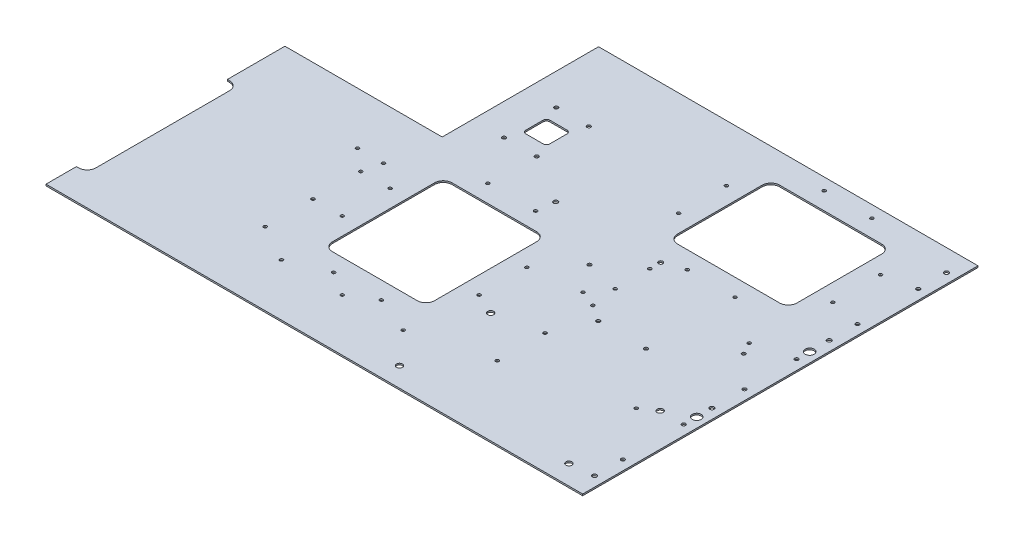
from build123d import *

# Parameters (mm, degrees)
BASE_FLANGE1_DEPTH                             = 577.85
SKETCH7_W                                      = 354.647501395
SKETCH7_H                                      = 622.579194054
CE_00_BIG_CORNER_CUT_DEPTH                     = 641.586892148
SKETCH8_R                                      = 2.3876
SKETCH8_R_2                                    = 3.175
CE_00_EXHAUST_VENT_DEPTH                       = 7.62
SKETCH13_R                                     = 2.3876
CE_00_HOLES_PLENUM_0_188_DEPTH                 = 7.62
SKETCH12_R                                     = 2.3876
SKETCH12_R_2                                   = 2.7051
CE_00_INTAKE_VENT_0_188_0_213_DEPTH            = 7.62
SKETCH14_R                                     = 4.3688
CE_00_HOLES_BOTTOM_SUPPORT_0_344_DEPTH         = 7.62
CE_00_HOLES_BOTTOM_FAN_PLATES_0_188_REACH      = 707.606
SKETCH21_R                                     = 2.3876
SKETCH21_R_2                                   = 3.175
SKETCH19_R                                     = 2.3876
CE_00_HOLES_ELECTRONICS_LOCATION_0_188_DEPTH   = 7.62
SKETCH15_R                                     = 2.3876
CE_00_HOLES_PLENUM_BOTTOM_0_188_DEPTH          = 7.62
SKETCH16_R                                     = 2.7051
CE_00_POWER_CONNECTOR_0_188_DEPTH              = 2.54
CE_00_HOLES_INTAKE_BRACKET_0_188_REACH         = 688.172
SKETCH24_R                                     = 2.3876
SKETCH17_R                                     = 3.175
SKETCH17_R_2                                   = 2.7051
SKETCH17_R_3                                   = 6.5532
CE_00_HOLES_SIDE_LOWR_FLANGE_0_213_0_250_DEPTH = 7.62
CE_00_TOP_EDGE_CUT_DEPTH                       = 50.8
FLAT_PATTERN1_START                            = -234.95
FLAT_PATTERN1_OUTLINE_R                        = 2.3876
FLAT_PATTERN1_OUTLINE_R_2                      = 4.3688
FLAT_PATTERN1_OUTLINE_R_3                      = 2.7051
FLAT_PATTERN1_OUTLINE_R_4                      = 3.175
FLAT_PATTERN1_DEPTH                            = 376.936
FLAT_PATTERN1_START_2                          = -237.236
FLAT_PATTERN1_2_OUTLINE_R                      = 2.3876
FLAT_PATTERN1_2_OUTLINE_R_2                    = 4.3688
FLAT_PATTERN1_2_OUTLINE_R_3                    = 2.7051
FLAT_PATTERN1_2_OUTLINE_R_4                    = 3.175
FLAT_PATTERN1_2_OUTLINE_R_5                    = 6.5532
FLAT_PATTERN1_2_DEPTH                          = 2.286


with BuildPart() as part:
    # Base-Flange1: sheet metal written as solids
    # Sketch1 → Base-Flange1 (new body)
    with BuildSketch(Plane.XY):
        with BuildLine():
            Line((139.7, -203.2), (139.7, -233.807))
            ThreePointArc((139.7, -233.807), (139.365223051, -234.615223051), (138.557, -234.95))
            Line((138.557, -234.95), (-138.557, -234.95))
            ThreePointArc((-138.557, -234.95), (-139.365223051, -234.615223051), (-139.7, -233.807))
            Line((-139.7, -233.807), (-139.7, 63.026553898))
            ThreePointArc((-139.7, 63.026553898), (-139.612994306, 63.463961061), (-139.365223051, 63.834776949))
            Line((-139.365223051, 63.834776949), (-63.834776949, 139.365223051))
            ThreePointArc((-63.834776949, 139.365223051), (-63.463961061, 139.612994306), (-63.026553898, 139.7))
            Line((-63.026553898, 139.7), (0, 139.7))
            Line((0, 139.7), (0, 141.986))
            Line((0, 141.986), (-63.026553898, 141.986))
            ThreePointArc((-63.026553898, 141.986), (-64.338775388, 141.724982917), (-65.451223051, 140.981669153))
            Line((-65.451223051, 140.981669153), (-140.981669153, 65.451223051))
            ThreePointArc((-140.981669153, 65.451223051), (-141.724982917, 64.338775388), (-141.986, 63.026553898))
            Line((-141.986, 63.026553898), (-141.986, -233.807))
            ThreePointArc((-141.986, -233.807), (-140.981669153, -236.231669153), (-138.557, -237.236))
            Line((-138.557, -237.236), (138.557, -237.236))
            ThreePointArc((138.557, -237.236), (140.981669153, -236.231669153), (141.986, -233.807))
            Line((141.986, -233.807), (141.986, -203.2))
            Line((141.986, -203.2), (139.7, -203.2))
        make_face()
    extrude(amount=-BASE_FLANGE1_DEPTH)

    # Sketch7 → CE-00 Big Corner Cut (cut, through all)
    with BuildSketch(Plane(origin=(0, 0, 0), x_dir=(0, 0, -1), z_dir=(1, 0, 0))):
        with Locations((526.573750698, 317.639597027)):
            Rectangle(SKETCH7_W, SKETCH7_H)
    extrude(amount=-CE_00_BIG_CORNER_CUT_DEPTH, mode=Mode.SUBTRACT)

    # Sketch8 → CE-00 Exhaust Vent (cut)
    with BuildSketch(Plane.ZY.offset(141.986)):
        with Locations(Location((-98.4123, -85.725, 0), (0, 0, 270))):
            Circle(SKETCH8_R)
        with Locations(Location((-98.4123, -155.575, 0), (0, 0, 270))):
            Circle(SKETCH8_R)
        with Locations(Location((-323.8627, -85.725, 0), (0, 0, 270))):
            Circle(SKETCH8_R)
        with Locations(Location((-323.8627, -155.575, 0), (0, 0, 270))):
            Circle(SKETCH8_R)
        with Locations(Location((-246.0625, -20.6248, 0), (0, 0, 270))):
            Circle(SKETCH8_R)
        with Locations(Location((-176.2125, -20.6248, 0), (0, 0, 270))):
            Circle(SKETCH8_R)
        with Locations(Location((-246.0625, -220.6752, 0), (0, 0, 270))):
            Circle(SKETCH8_R)
        with Locations(Location((-176.2125, -220.6752, 0), (0, 0, 270))):
            Circle(SKETCH8_R)
        with Locations(Location((-350.0628, -158.75, 0), (0, 0, 270))):
            Circle(SKETCH8_R_2)
        with BuildLine():
            Line((-285.75, -46.0375), (-136.525, -46.0375))
            ThreePointArc((-136.525, -46.0375), (-127.544743879, -49.757243879), (-123.825, -58.7375))
            Line((-123.825, -58.7375), (-123.825, -182.5625))
            ThreePointArc((-123.825, -182.5625), (-127.544743879, -191.542756121), (-136.525, -195.2625))
            Line((-136.525, -195.2625), (-285.75, -195.2625))
            ThreePointArc((-285.75, -195.2625), (-294.730256121, -191.542756121), (-298.45, -182.5625))
            Line((-298.45, -182.5625), (-298.45, -58.7375))
            ThreePointArc((-298.45, -58.7375), (-294.730256121, -49.757243879), (-285.75, -46.0375))
        make_face()
    extrude(amount=-CE_00_EXHAUST_VENT_DEPTH, mode=Mode.SUBTRACT)

    # Sketch13 → CE-00 Holes Plenum 0.188 (cut)
    with BuildSketch(Plane.ZY.offset(141.986)):
        with Locations((-76.2, -31.75)):
            Circle(SKETCH13_R)
        with Locations((-76.2, -120.65)):
            Circle(SKETCH13_R)
        with Locations((-76.2, -209.55)):
            Circle(SKETCH13_R)
        with Locations((-246.0752, 22.225)):
            Circle(SKETCH13_R)
        with Locations((-176.2252, 22.225)):
            Circle(SKETCH13_R)
        with Locations((-106.3752, 22.225)):
            Circle(SKETCH13_R)
    extrude(amount=-CE_00_HOLES_PLENUM_0_188_DEPTH, mode=Mode.SUBTRACT)

    # Sketch12 → CE-00 Intake Vent 0.188 0.213 (cut)
    with BuildSketch(Plane(origin=(0, -237.236, 0), x_dir=(1, 0, 0), z_dir=(0, 1, 0))):
        with Locations((-34.925, 360.3498)):
            Circle(SKETCH12_R)
        with Locations((34.925, 360.3498)):
            Circle(SKETCH12_R)
        with Locations((-34.925, 560.4002)):
            Circle(SKETCH12_R)
        with Locations((34.925, 560.4002)):
            Circle(SKETCH12_R)
        with Locations((112.7252, 495.3)):
            Circle(SKETCH12_R)
        with Locations((112.7252, 425.45)):
            Circle(SKETCH12_R)
        with Locations((-112.7252, 425.45)):
            Circle(SKETCH12_R)
        with Locations((-112.7252, 495.3)):
            Circle(SKETCH12_R)
        with Locations((34.925, 230.2002)):
            Circle(SKETCH12_R_2)
        with Locations((-34.925, 230.2002)):
            Circle(SKETCH12_R_2)
        with Locations((112.7252, 295.275)):
            Circle(SKETCH12_R_2)
        with Locations((-112.7252, 295.275)):
            Circle(SKETCH12_R_2)
        with BuildLine():
            Line((-74.6125, 385.7625), (74.6125, 385.7625))
            ThreePointArc((74.6125, 385.7625), (83.592756121, 389.482243879), (87.3125, 398.4625))
            Line((87.3125, 398.4625), (87.3125, 522.2875))
            ThreePointArc((87.3125, 522.2875), (83.592756121, 531.267756121), (74.6125, 534.9875))
            Line((74.6125, 534.9875), (-74.6125, 534.9875))
            ThreePointArc((-74.6125, 534.9875), (-83.592756121, 531.267756121), (-87.3125, 522.2875))
            Line((-87.3125, 522.2875), (-87.3125, 398.4625))
            ThreePointArc((-87.3125, 398.4625), (-83.592756121, 389.482243879), (-74.6125, 385.7625))
        make_face()
    extrude(amount=CE_00_INTAKE_VENT_0_188_0_213_DEPTH, mode=Mode.SUBTRACT)

    # Sketch14 → CE-00 Holes Bottom Support 0.344 (cut)
    with BuildSketch(Plane.XZ.offset(237.236)):
        with Locations((-123.825, -28.575)):
            Circle(SKETCH14_R)
        with Locations((-123.825, -161.925)):
            Circle(SKETCH14_R)
        with Locations((123.825, -28.575)):
            Circle(SKETCH14_R)
        with Locations((123.825, -161.925)):
            Circle(SKETCH14_R)
    extrude(amount=-CE_00_HOLES_BOTTOM_SUPPORT_0_344_DEPTH, mode=Mode.SUBTRACT)

    # Sketch21 → CE-00 Holes Bottom Fan Plates 0.188 (cut, up to next)
    with BuildSketch(Plane.XZ.offset(237.236), mode=Mode.PRIVATE) as ce_00_holes_bottom_fan_plates_0_188_sk1:
        with Locations((-82.55, -255.5875)):
            Circle(SKETCH21_R)
    ce_00_holes_bottom_fan_plates_0_188_tool1 = extrude(ce_00_holes_bottom_fan_plates_0_188_sk1.sketch, amount=-CE_00_HOLES_BOTTOM_FAN_PLATES_0_188_REACH, mode=Mode.PRIVATE) & part.part
    # Sketch21 → CE-00 Holes Bottom Fan Plates 0.188 (cut, up to next)
    with BuildSketch(Plane.XZ.offset(237.236), mode=Mode.PRIVATE) as ce_00_holes_bottom_fan_plates_0_188_sk2:
        with Locations((-63.5, -350.0628)):
            Circle(SKETCH21_R_2)
    ce_00_holes_bottom_fan_plates_0_188_tool2 = extrude(ce_00_holes_bottom_fan_plates_0_188_sk2.sketch, amount=-CE_00_HOLES_BOTTOM_FAN_PLATES_0_188_REACH, mode=Mode.PRIVATE) & part.part
    # Sketch21 → CE-00 Holes Bottom Fan Plates 0.188 (cut, up to next)
    with BuildSketch(Plane.XZ.offset(237.236), mode=Mode.PRIVATE) as ce_00_holes_bottom_fan_plates_0_188_sk3:
        with Locations((-63.5, -283.3878)):
            Circle(SKETCH21_R)
    ce_00_holes_bottom_fan_plates_0_188_tool3 = extrude(ce_00_holes_bottom_fan_plates_0_188_sk3.sketch, amount=-CE_00_HOLES_BOTTOM_FAN_PLATES_0_188_REACH, mode=Mode.PRIVATE) & part.part
    # Sketch21 → CE-00 Holes Bottom Fan Plates 0.188 (cut, up to next)
    with BuildSketch(Plane.XZ.offset(237.236), mode=Mode.PRIVATE) as ce_00_holes_bottom_fan_plates_0_188_sk4:
        with Locations((-63.5, -334.1878)):
            Circle(SKETCH21_R)
    ce_00_holes_bottom_fan_plates_0_188_tool4 = extrude(ce_00_holes_bottom_fan_plates_0_188_sk4.sketch, amount=-CE_00_HOLES_BOTTOM_FAN_PLATES_0_188_REACH, mode=Mode.PRIVATE) & part.part
    add(ce_00_holes_bottom_fan_plates_0_188_tool1.solids().sort_by_distance((-82.55, -237.236, -255.5875))[0], mode=Mode.SUBTRACT)
    add(ce_00_holes_bottom_fan_plates_0_188_tool2.solids().sort_by_distance((-63.5, -237.236, -350.0628))[0], mode=Mode.SUBTRACT)
    add(ce_00_holes_bottom_fan_plates_0_188_tool3.solids().sort_by_distance((-63.5, -237.236, -283.3878))[0], mode=Mode.SUBTRACT)
    add(ce_00_holes_bottom_fan_plates_0_188_tool4.solids().sort_by_distance((-63.5, -237.236, -334.1878))[0], mode=Mode.SUBTRACT)

    # Sketch19 → CE-00 Holes Electronics Location 0.188 (cut)
    with BuildSketch(Plane.XZ.offset(237.236)):
        with Locations((103.1748, -312.7375)):
            Circle(SKETCH19_R)
        with Locations((103.1748, -147.6375)):
            Circle(SKETCH19_R)
    extrude(amount=-CE_00_HOLES_ELECTRONICS_LOCATION_0_188_DEPTH, mode=Mode.SUBTRACT)

    # Sketch15 → CE-00 Holes Plenum Bottom 0.188 (cut)
    with BuildSketch(Plane.XZ.offset(237.236)):
        with Locations((-58.7502, -106.3752)):
            Circle(SKETCH15_R)
        with Locations((-58.7502, -176.2252)):
            Circle(SKETCH15_R)
        with Locations((-58.7502, -246.0752)):
            Circle(SKETCH15_R)
    extrude(amount=-CE_00_HOLES_PLENUM_BOTTOM_0_188_DEPTH, mode=Mode.SUBTRACT)

    # Sketch16 → CE-00 Power Connector 0.188 (cut)
    with BuildSketch(Plane.ZY.offset(141.986)):
        with Locations((-469.9, -39.6748)):
            Circle(SKETCH16_R)
        with Locations((-469.9, -87.3252)):
            Circle(SKETCH16_R)
        with Locations((-393.7, -87.3252)):
            Circle(SKETCH16_R)
        with Locations((-393.7, -39.6748)):
            Circle(SKETCH16_R)
        with BuildLine():
            Line((-444.4873, -46.0375), (-419.1127, -46.0375))
            ThreePointArc((-419.1127, -46.0375), (-415.736123698, -47.436123698), (-414.3375, -50.8127))
            Line((-414.3375, -50.8127), (-414.3375, -76.1873))
            ThreePointArc((-414.3375, -76.1873), (-415.736123698, -79.563876302), (-419.1127, -80.9625))
            Line((-419.1127, -80.9625), (-444.4873, -80.9625))
            ThreePointArc((-444.4873, -80.9625), (-447.863876302, -79.563876302), (-449.2625, -76.1873))
            Line((-449.2625, -76.1873), (-449.2625, -50.8127))
            ThreePointArc((-449.2625, -50.8127), (-447.863876302, -47.436123698), (-444.4873, -46.0375))
        make_face()
    extrude(amount=-CE_00_POWER_CONNECTOR_0_188_DEPTH, mode=Mode.SUBTRACT)

    # Sketch24 → CE-00 Holes Intake Bracket 0.188 (cut, up to next)
    with BuildSketch(Plane.ZY.offset(141.986), mode=Mode.PRIVATE) as ce_00_holes_intake_bracket_0_188_sk1:
        with Locations((-273.05, 53.975)):
            Circle(SKETCH24_R)
    ce_00_holes_intake_bracket_0_188_tool1 = extrude(ce_00_holes_intake_bracket_0_188_sk1.sketch, amount=-CE_00_HOLES_INTAKE_BRACKET_0_188_REACH, mode=Mode.PRIVATE) & part.part
    # Sketch24 → CE-00 Holes Intake Bracket 0.188 (cut, up to next)
    with BuildSketch(Plane.ZY.offset(141.986), mode=Mode.PRIVATE) as ce_00_holes_intake_bracket_0_188_sk2:
        with Locations((-273.05, 15.875)):
            Circle(SKETCH24_R)
    ce_00_holes_intake_bracket_0_188_tool2 = extrude(ce_00_holes_intake_bracket_0_188_sk2.sketch, amount=-CE_00_HOLES_INTAKE_BRACKET_0_188_REACH, mode=Mode.PRIVATE) & part.part
    add(ce_00_holes_intake_bracket_0_188_tool1.solids().sort_by_distance((-141.986, 53.975, -273.05))[0], mode=Mode.SUBTRACT)
    add(ce_00_holes_intake_bracket_0_188_tool2.solids().sort_by_distance((-141.986, 15.875, -273.05))[0], mode=Mode.SUBTRACT)

    # Sketch17 → CE-00 Holes Side Lowr Flange 0.213 0.250 0.516 (cut)
    with BuildSketch(Plane(origin=(141.986, 0, 0), x_dir=(0, 0, -1), z_dir=(1, 0, 0))):
        with Locations(Location((31.75, -217.5002, 0), (0, 0, 90))):
            Circle(SKETCH17_R)
        with Locations(Location((203.2, -217.5002, 0), (0, 0, 90))):
            Circle(SKETCH17_R)
        with Locations(Location((374.65, -217.5002, 0), (0, 0, 90))):
            Circle(SKETCH17_R)
        with Locations(Location((546.1, -217.5002, 0), (0, 0, 90))):
            Circle(SKETCH17_R)
        with Locations(Location((73.025, -217.5002, 0), (0, 0, 90))):
            Circle(SKETCH17_R_2)
        with Locations(Location((504.825, -217.5002, 0), (0, 0, 90))):
            Circle(SKETCH17_R_2)
        with Locations(Location((327.025, -217.5002, 0), (0, 0, 90))):
            Circle(SKETCH17_R_2)
        with Locations(Location((250.825, -217.5002, 0), (0, 0, 90))):
            Circle(SKETCH17_R_2)
        with Locations(Location((346.075, -217.5002, 0), (0, 0, 90))):
            Circle(SKETCH17_R_3)
        with Locations(Location((180.975, -217.5002, 0), (0, 0, 90))):
            Circle(SKETCH17_R_3)
        with Locations(Location((161.925, -217.5002, 0), (0, 0, 90))):
            Circle(SKETCH17_R_2)
        with Locations(Location((415.925, -217.5002, 0), (0, 0, 90))):
            Circle(SKETCH17_R_2)
    extrude(amount=-CE_00_HOLES_SIDE_LOWR_FLANGE_0_213_0_250_DEPTH, mode=Mode.SUBTRACT)

    # Sketch18 → CE-00 Top Edge Cut (cut)
    with BuildSketch(Plane(origin=(0, 141.986, 0), x_dir=(1, 0, 0), z_dir=(0, 1, 0))):
        with BuildLine():
            Line((-15.875, 57.15), (-15.875, 252.4252))
            ThreePointArc((-15.875, 252.4252), (-12.155256121, 261.405456121), (-3.175, 265.1252))
            Line((-3.175, 265.1252), (31.035276917, 265.1252))
            Line((31.035276917, 265.1252), (31.035276917, 44.45))
            Line((31.035276917, 44.45), (-3.175, 44.45))
            ThreePointArc((-3.175, 44.45), (-12.155256121, 48.169743879), (-15.875, 57.15))
        make_face()
    extrude(amount=-CE_00_TOP_EDGE_CUT_DEPTH, mode=Mode.SUBTRACT)

    # Flat-Pattern1: read off the stored shape, not the designer's step
    # Flat-Pattern1 outline → Flat-Pattern1 (cut)
    with BuildSketch(Plane(origin=(0, 0, 0), x_dir=(1, 0, 0), z_dir=(0, 1, 0)).offset(FLAT_PATTERN1_START)):
        with BuildLine():
            Line((-382.089389979, 577.85), (-382.089389979, 349.25))
            Line((-382.089389979, 349.25), (-611.984069003, 349.25))
            Line((-611.984069003, 349.25), (-611.984069003, 265.1252))
            Line((-611.984069003, 265.1252), (-608.809069003, 265.1252))
            ThreePointArc((-608.809069003, 265.1252), (-599.828812882, 261.405456121), (-596.109069003, 252.4252))
            Line((-596.109069003, 252.4252), (-596.109069003, 57.15))
            ThreePointArc((-596.109069003, 57.15), (-599.828812882, 48.169743879), (-608.809069003, 44.45))
            Line((-608.809069003, 44.45), (-611.984069003, 44.45))
            Line((-611.984069003, 44.45), (-611.984069003, 0))
            Line((-611.984069003, 0), (141.986, 0))
            Line((141.986, 0), (141.986, 577.85))
            Line((141.986, 577.85), (-382.089389979, 577.85))
        make_face()
        with Locations((-397.964389979, 106.3752)):
            Circle(FLAT_PATTERN1_OUTLINE_R, mode=Mode.SUBTRACT)
        with Locations((-343.989389979, 76.2)):
            Circle(FLAT_PATTERN1_OUTLINE_R, mode=Mode.SUBTRACT)
        with Locations((-290.014389979, 98.4123)):
            Circle(FLAT_PATTERN1_OUTLINE_R, mode=Mode.SUBTRACT)
        with Locations((-255.089389979, 76.2)):
            Circle(FLAT_PATTERN1_OUTLINE_R, mode=Mode.SUBTRACT)
        with Locations((-220.164389979, 98.4123)):
            Circle(FLAT_PATTERN1_OUTLINE_R, mode=Mode.SUBTRACT)
        with Locations((-429.714389979, 273.05)):
            Circle(FLAT_PATTERN1_OUTLINE_R, mode=Mode.SUBTRACT)
        with Locations((-397.964389979, 176.2252)):
            Circle(FLAT_PATTERN1_OUTLINE_R, mode=Mode.SUBTRACT)
        with Locations((-355.114589979, 176.2125)):
            Circle(FLAT_PATTERN1_OUTLINE_R, mode=Mode.SUBTRACT)
        with BuildLine():
            Line((-317.001889979, 298.45), (-193.176889979, 298.45))
            ThreePointArc((-193.176889979, 298.45), (-184.196633858, 294.730256121), (-180.476889979, 285.75))
            Line((-180.476889979, 285.75), (-180.476889979, 136.525))
            ThreePointArc((-180.476889979, 136.525), (-184.196633858, 127.544743879), (-193.176889979, 123.825))
            Line((-193.176889979, 123.825), (-317.001889979, 123.825))
            ThreePointArc((-317.001889979, 123.825), (-325.9821461, 127.544743879), (-329.701889979, 136.525))
            Line((-329.701889979, 136.525), (-329.701889979, 285.75))
            ThreePointArc((-329.701889979, 285.75), (-325.9821461, 294.730256121), (-317.001889979, 298.45))
        make_face(mode=Mode.SUBTRACT)
        with Locations((-397.964389979, 246.0752)):
            Circle(FLAT_PATTERN1_OUTLINE_R, mode=Mode.SUBTRACT)
        with Locations((-355.114589979, 246.0625)):
            Circle(FLAT_PATTERN1_OUTLINE_R, mode=Mode.SUBTRACT)
        with Locations((-391.614389979, 273.05)):
            Circle(FLAT_PATTERN1_OUTLINE_R, mode=Mode.SUBTRACT)
        with Locations((-166.189389979, 76.2)):
            Circle(FLAT_PATTERN1_OUTLINE_R, mode=Mode.SUBTRACT)
        with Locations((123.825, 28.575)):
            Circle(FLAT_PATTERN1_OUTLINE_R_2, mode=Mode.SUBTRACT)
        with Locations((-155.064189979, 176.2125)):
            Circle(FLAT_PATTERN1_OUTLINE_R, mode=Mode.SUBTRACT)
        with Locations((-155.064189979, 246.0625)):
            Circle(FLAT_PATTERN1_OUTLINE_R, mode=Mode.SUBTRACT)
        with Locations((103.1748, 147.6375)):
            Circle(FLAT_PATTERN1_OUTLINE_R, mode=Mode.SUBTRACT)
        with Locations((123.825, 161.925)):
            Circle(FLAT_PATTERN1_OUTLINE_R_2, mode=Mode.SUBTRACT)
        with Locations((34.925, 230.2002)):
            Circle(FLAT_PATTERN1_OUTLINE_R_3, mode=Mode.SUBTRACT)
        with Locations((-290.014389979, 323.8627)):
            Circle(FLAT_PATTERN1_OUTLINE_R, mode=Mode.SUBTRACT)
        with Locations((-220.164389979, 323.8627)):
            Circle(FLAT_PATTERN1_OUTLINE_R, mode=Mode.SUBTRACT)
        with Locations((-336.064589979, 393.7)):
            Circle(FLAT_PATTERN1_OUTLINE_R_3, mode=Mode.SUBTRACT)
        with Locations((-288.414189979, 393.7)):
            Circle(FLAT_PATTERN1_OUTLINE_R_3, mode=Mode.SUBTRACT)
        with BuildLine():
            Line((-324.926689979, 449.2625), (-299.552089979, 449.2625))
            ThreePointArc((-299.552089979, 449.2625), (-296.175513677, 447.863876302), (-294.776889979, 444.4873))
            Line((-294.776889979, 444.4873), (-294.776889979, 419.1127))
            ThreePointArc((-294.776889979, 419.1127), (-296.175513677, 415.736123698), (-299.552089979, 414.3375))
            Line((-299.552089979, 414.3375), (-324.926689979, 414.3375))
            ThreePointArc((-324.926689979, 414.3375), (-328.30326628, 415.736123698), (-329.701889979, 419.1127))
            Line((-329.701889979, 419.1127), (-329.701889979, 444.4873))
            ThreePointArc((-329.701889979, 444.4873), (-328.30326628, 447.863876302), (-324.926689979, 449.2625))
        make_face(mode=Mode.SUBTRACT)
        with Locations((-336.064589979, 469.9)):
            Circle(FLAT_PATTERN1_OUTLINE_R_3, mode=Mode.SUBTRACT)
        with Locations((-288.414189979, 469.9)):
            Circle(FLAT_PATTERN1_OUTLINE_R_3, mode=Mode.SUBTRACT)
        with Locations((-216.989389979, 350.0628)):
            Circle(FLAT_PATTERN1_OUTLINE_R_4, mode=Mode.SUBTRACT)
        with Locations((-34.925, 360.3498)):
            Circle(FLAT_PATTERN1_OUTLINE_R, mode=Mode.SUBTRACT)
        with Locations((-112.7252, 425.45)):
            Circle(FLAT_PATTERN1_OUTLINE_R, mode=Mode.SUBTRACT)
        with Locations((34.925, 360.3498)):
            Circle(FLAT_PATTERN1_OUTLINE_R, mode=Mode.SUBTRACT)
        with Locations((112.7252, 295.275)):
            Circle(FLAT_PATTERN1_OUTLINE_R_3, mode=Mode.SUBTRACT)
        with Locations((103.1748, 312.7375)):
            Circle(FLAT_PATTERN1_OUTLINE_R, mode=Mode.SUBTRACT)
        with Locations((112.7252, 425.45)):
            Circle(FLAT_PATTERN1_OUTLINE_R, mode=Mode.SUBTRACT)
        with Locations((-112.7252, 495.3)):
            Circle(FLAT_PATTERN1_OUTLINE_R, mode=Mode.SUBTRACT)
        with Locations((-34.925, 560.4002)):
            Circle(FLAT_PATTERN1_OUTLINE_R, mode=Mode.SUBTRACT)
        with BuildLine():
            ThreePointArc((87.3125, 398.4625), (83.592756121, 389.482243879), (74.6125, 385.7625))
            Line((74.6125, 385.7625), (-74.6125, 385.7625))
            ThreePointArc((-74.6125, 385.7625), (-83.592756121, 389.482243879), (-87.3125, 398.4625))
            Line((-87.3125, 398.4625), (-87.3125, 522.2875))
            ThreePointArc((-87.3125, 522.2875), (-83.592756121, 531.267756121), (-74.6125, 534.9875))
            Line((-74.6125, 534.9875), (74.6125, 534.9875))
            ThreePointArc((74.6125, 534.9875), (83.592756121, 531.267756121), (87.3125, 522.2875))
            Line((87.3125, 522.2875), (87.3125, 398.4625))
        make_face(mode=Mode.SUBTRACT)
        with Locations((112.7252, 495.3)):
            Circle(FLAT_PATTERN1_OUTLINE_R, mode=Mode.SUBTRACT)
        with Locations((34.925, 560.4002)):
            Circle(FLAT_PATTERN1_OUTLINE_R, mode=Mode.SUBTRACT)
    extrude(amount=FLAT_PATTERN1_DEPTH, mode=Mode.SUBTRACT)

    # Flat-Pattern1 2 outline → Flat-Pattern1 2 (add)
    with BuildSketch(Plane(origin=(0, 0, 0), x_dir=(1, 0, 0), z_dir=(0, 1, 0)).offset(FLAT_PATTERN1_START_2)):
        with BuildLine():
            Line((-382.089389979, 577.85), (-382.089389979, 349.25))
            Line((-382.089389979, 349.25), (-611.984069003, 349.25))
            Line((-611.984069003, 349.25), (-611.984069003, 265.1252))
            Line((-611.984069003, 265.1252), (-608.809069003, 265.1252))
            ThreePointArc((-608.809069003, 265.1252), (-599.828812882, 261.405456121), (-596.109069003, 252.4252))
            Line((-596.109069003, 252.4252), (-596.109069003, 57.15))
            ThreePointArc((-596.109069003, 57.15), (-599.828812882, 48.169743879), (-608.809069003, 44.45))
            Line((-608.809069003, 44.45), (-611.984069003, 44.45))
            Line((-611.984069003, 44.45), (-611.984069003, 0))
            Line((-611.984069003, 0), (-63.026553898, 0))
            Line((-63.026553898, 0), (-63.026553898, 281.047611429))
            ThreePointArc((-63.026553898, 281.047611429), (-65.8876, 283.3878), (-63.026553898, 285.727988571))
            Line((-63.026553898, 285.727988571), (-63.026553898, 331.847611429))
            ThreePointArc((-63.026553898, 331.847611429), (-65.8876, 334.1878), (-63.026553898, 336.527988571))
            Line((-63.026553898, 336.527988571), (-63.026553898, 346.923297844))
            ThreePointArc((-63.026553898, 346.923297844), (-65.619190629, 352.42704535), (-60.430801219, 349.25))
            Line((-60.430801219, 349.25), (0, 349.25))
            Line((0, 349.25), (0, 265.1252))
            Line((0, 265.1252), (-3.175, 265.1252))
            ThreePointArc((-3.175, 265.1252), (-12.155256121, 261.405456121), (-15.875, 252.4252))
            Line((-15.875, 252.4252), (-15.875, 57.15))
            ThreePointArc((-15.875, 57.15), (-12.155256121, 48.169743879), (-3.175, 44.45))
            Line((-3.175, 44.45), (0, 44.45))
            Line((0, 44.45), (0, 0))
            Line((0, 0), (172.539389979, 0))
            Line((172.539389979, 0), (172.539389979, 577.85))
            Line((172.539389979, 577.85), (-382.089389979, 577.85))
        make_face()
        with Locations((-397.964389979, 106.3752)):
            Circle(FLAT_PATTERN1_2_OUTLINE_R, mode=Mode.SUBTRACT)
        with Locations((-343.989389979, 76.2)):
            Circle(FLAT_PATTERN1_2_OUTLINE_R, mode=Mode.SUBTRACT)
        with Locations((-290.014389979, 98.4123)):
            Circle(FLAT_PATTERN1_2_OUTLINE_R, mode=Mode.SUBTRACT)
        with Locations((-255.089389979, 76.2)):
            Circle(FLAT_PATTERN1_2_OUTLINE_R, mode=Mode.SUBTRACT)
        with Locations((-220.164389979, 98.4123)):
            Circle(FLAT_PATTERN1_2_OUTLINE_R, mode=Mode.SUBTRACT)
        with Locations((-429.714389979, 273.05)):
            Circle(FLAT_PATTERN1_2_OUTLINE_R, mode=Mode.SUBTRACT)
        with Locations((-397.964389979, 176.2252)):
            Circle(FLAT_PATTERN1_2_OUTLINE_R, mode=Mode.SUBTRACT)
        with Locations((-355.114589979, 176.2125)):
            Circle(FLAT_PATTERN1_2_OUTLINE_R, mode=Mode.SUBTRACT)
        with BuildLine():
            Line((-317.001889979, 298.45), (-193.176889979, 298.45))
            ThreePointArc((-193.176889979, 298.45), (-184.196633858, 294.730256121), (-180.476889979, 285.75))
            Line((-180.476889979, 285.75), (-180.476889979, 136.525))
            ThreePointArc((-180.476889979, 136.525), (-184.196633858, 127.544743879), (-193.176889979, 123.825))
            Line((-193.176889979, 123.825), (-317.001889979, 123.825))
            ThreePointArc((-317.001889979, 123.825), (-325.9821461, 127.544743879), (-329.701889979, 136.525))
            Line((-329.701889979, 136.525), (-329.701889979, 285.75))
            ThreePointArc((-329.701889979, 285.75), (-325.9821461, 294.730256121), (-317.001889979, 298.45))
        make_face(mode=Mode.SUBTRACT)
        with Locations((-397.964389979, 246.0752)):
            Circle(FLAT_PATTERN1_2_OUTLINE_R, mode=Mode.SUBTRACT)
        with Locations((-355.114589979, 246.0625)):
            Circle(FLAT_PATTERN1_2_OUTLINE_R, mode=Mode.SUBTRACT)
        with Locations((-391.614389979, 273.05)):
            Circle(FLAT_PATTERN1_2_OUTLINE_R, mode=Mode.SUBTRACT)
        with Locations((-123.825, 28.575)):
            Circle(FLAT_PATTERN1_2_OUTLINE_R_2, mode=Mode.SUBTRACT)
        with Locations((-166.189389979, 76.2)):
            Circle(FLAT_PATTERN1_2_OUTLINE_R, mode=Mode.SUBTRACT)
        with Locations((123.825, 28.575)):
            Circle(FLAT_PATTERN1_2_OUTLINE_R_2, mode=Mode.SUBTRACT)
        with Locations((-123.825, 161.925)):
            Circle(FLAT_PATTERN1_2_OUTLINE_R_2, mode=Mode.SUBTRACT)
        with Locations((-155.064189979, 176.2125)):
            Circle(FLAT_PATTERN1_2_OUTLINE_R, mode=Mode.SUBTRACT)
        with Locations((-155.064189979, 246.0625)):
            Circle(FLAT_PATTERN1_2_OUTLINE_R, mode=Mode.SUBTRACT)
        with Locations((-82.55, 255.5875)):
            Circle(FLAT_PATTERN1_2_OUTLINE_R, mode=Mode.SUBTRACT)
        with Locations((103.1748, 147.6375)):
            Circle(FLAT_PATTERN1_2_OUTLINE_R, mode=Mode.SUBTRACT)
        with Locations((123.825, 161.925)):
            Circle(FLAT_PATTERN1_2_OUTLINE_R_2, mode=Mode.SUBTRACT)
        with Locations((34.925, 230.2002)):
            Circle(FLAT_PATTERN1_2_OUTLINE_R_3, mode=Mode.SUBTRACT)
        with Locations((-290.014389979, 323.8627)):
            Circle(FLAT_PATTERN1_2_OUTLINE_R, mode=Mode.SUBTRACT)
        with Locations((-220.164389979, 323.8627)):
            Circle(FLAT_PATTERN1_2_OUTLINE_R, mode=Mode.SUBTRACT)
        with Locations((-336.064589979, 393.7)):
            Circle(FLAT_PATTERN1_2_OUTLINE_R_3, mode=Mode.SUBTRACT)
        with Locations((-288.414189979, 393.7)):
            Circle(FLAT_PATTERN1_2_OUTLINE_R_3, mode=Mode.SUBTRACT)
        with BuildLine():
            Line((-324.926689979, 449.2625), (-299.552089979, 449.2625))
            ThreePointArc((-299.552089979, 449.2625), (-296.175513677, 447.863876302), (-294.776889979, 444.4873))
            Line((-294.776889979, 444.4873), (-294.776889979, 419.1127))
            ThreePointArc((-294.776889979, 419.1127), (-296.175513677, 415.736123698), (-299.552089979, 414.3375))
            Line((-299.552089979, 414.3375), (-324.926689979, 414.3375))
            ThreePointArc((-324.926689979, 414.3375), (-328.30326628, 415.736123698), (-329.701889979, 419.1127))
            Line((-329.701889979, 419.1127), (-329.701889979, 444.4873))
            ThreePointArc((-329.701889979, 444.4873), (-328.30326628, 447.863876302), (-324.926689979, 449.2625))
        make_face(mode=Mode.SUBTRACT)
        with Locations((-336.064589979, 469.9)):
            Circle(FLAT_PATTERN1_2_OUTLINE_R_3, mode=Mode.SUBTRACT)
        with Locations((-288.414189979, 469.9)):
            Circle(FLAT_PATTERN1_2_OUTLINE_R_3, mode=Mode.SUBTRACT)
        with Locations((-216.989389979, 350.0628)):
            Circle(FLAT_PATTERN1_2_OUTLINE_R_4, mode=Mode.SUBTRACT)
        with Locations((-112.7252, 295.275)):
            Circle(FLAT_PATTERN1_2_OUTLINE_R_3, mode=Mode.SUBTRACT)
        with Locations((-34.925, 360.3498)):
            Circle(FLAT_PATTERN1_2_OUTLINE_R, mode=Mode.SUBTRACT)
        with Locations((-112.7252, 425.45)):
            Circle(FLAT_PATTERN1_2_OUTLINE_R, mode=Mode.SUBTRACT)
        with Locations((34.925, 360.3498)):
            Circle(FLAT_PATTERN1_2_OUTLINE_R, mode=Mode.SUBTRACT)
        with Locations((112.7252, 295.275)):
            Circle(FLAT_PATTERN1_2_OUTLINE_R_3, mode=Mode.SUBTRACT)
        with Locations((103.1748, 312.7375)):
            Circle(FLAT_PATTERN1_2_OUTLINE_R, mode=Mode.SUBTRACT)
        with Locations((112.7252, 425.45)):
            Circle(FLAT_PATTERN1_2_OUTLINE_R, mode=Mode.SUBTRACT)
        with Locations((-112.7252, 495.3)):
            Circle(FLAT_PATTERN1_2_OUTLINE_R, mode=Mode.SUBTRACT)
        with Locations((-34.925, 560.4002)):
            Circle(FLAT_PATTERN1_2_OUTLINE_R, mode=Mode.SUBTRACT)
        with BuildLine():
            ThreePointArc((87.3125, 398.4625), (83.592756121, 389.482243879), (74.6125, 385.7625))
            Line((74.6125, 385.7625), (-74.6125, 385.7625))
            ThreePointArc((-74.6125, 385.7625), (-83.592756121, 389.482243879), (-87.3125, 398.4625))
            Line((-87.3125, 398.4625), (-87.3125, 522.2875))
            ThreePointArc((-87.3125, 522.2875), (-83.592756121, 531.267756121), (-74.6125, 534.9875))
            Line((-74.6125, 534.9875), (74.6125, 534.9875))
            ThreePointArc((74.6125, 534.9875), (83.592756121, 531.267756121), (87.3125, 522.2875))
            Line((87.3125, 522.2875), (87.3125, 398.4625))
        make_face(mode=Mode.SUBTRACT)
        with Locations((112.7252, 495.3)):
            Circle(FLAT_PATTERN1_2_OUTLINE_R, mode=Mode.SUBTRACT)
        with Locations((34.925, 560.4002)):
            Circle(FLAT_PATTERN1_2_OUTLINE_R, mode=Mode.SUBTRACT)
        with Locations((158.239189979, 546.1)):
            Circle(FLAT_PATTERN1_2_OUTLINE_R_4, mode=Mode.SUBTRACT)
        with Locations((158.239189979, 31.75)):
            Circle(FLAT_PATTERN1_2_OUTLINE_R_4, mode=Mode.SUBTRACT)
        with Locations((158.239189979, 73.025)):
            Circle(FLAT_PATTERN1_2_OUTLINE_R_3, mode=Mode.SUBTRACT)
        with Locations((158.239189979, 161.925)):
            Circle(FLAT_PATTERN1_2_OUTLINE_R_3, mode=Mode.SUBTRACT)
        with Locations((158.239189979, 180.975)):
            Circle(FLAT_PATTERN1_2_OUTLINE_R_5, mode=Mode.SUBTRACT)
        with Locations((158.239189979, 203.2)):
            Circle(FLAT_PATTERN1_2_OUTLINE_R_4, mode=Mode.SUBTRACT)
        with Locations((158.239189979, 250.825)):
            Circle(FLAT_PATTERN1_2_OUTLINE_R_3, mode=Mode.SUBTRACT)
        with Locations((158.239189979, 327.025)):
            Circle(FLAT_PATTERN1_2_OUTLINE_R_3, mode=Mode.SUBTRACT)
        with Locations((158.239189979, 346.075)):
            Circle(FLAT_PATTERN1_2_OUTLINE_R_5, mode=Mode.SUBTRACT)
        with Locations((158.239189979, 374.65)):
            Circle(FLAT_PATTERN1_2_OUTLINE_R_4, mode=Mode.SUBTRACT)
        with Locations((158.239189979, 415.925)):
            Circle(FLAT_PATTERN1_2_OUTLINE_R_3, mode=Mode.SUBTRACT)
        with Locations((158.239189979, 504.825)):
            Circle(FLAT_PATTERN1_2_OUTLINE_R_3, mode=Mode.SUBTRACT)
    extrude(amount=FLAT_PATTERN1_2_DEPTH)


solid = part.part
